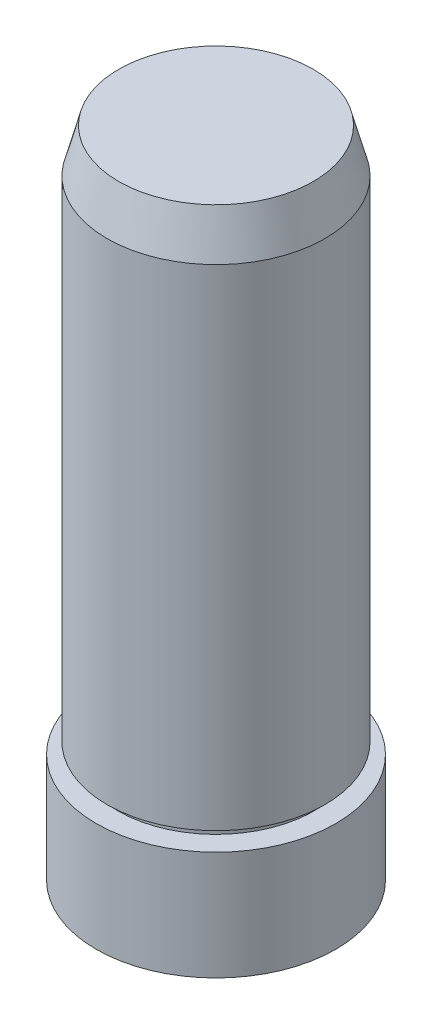
from build123d import *

# Parameters (mm, degrees)
SKETCH_1_R          = 10
EXTRUDE_1_DEPTH     = 50
SKETCH_2_R          = 11
EXTRUDE_2_DEPTH     = 10
CHAMFER_1_SIZE      = 4
CHAMFER_1_SIZE2     = 1.07179677
SKETCH_3_R          = 10
SKETCH_3_R_2        = 9
CUT_EXTRUDE_1_DEPTH = 1


with BuildPart() as part:
    # Эскиз1 → Бобышка-Вытянуть1 (new body)
    with BuildSketch(Plane(origin=(0, 0, 0), x_dir=(1, 0, 0), z_dir=(0, 1, 0))):
        Circle(SKETCH_1_R)
    extrude(amount=EXTRUDE_1_DEPTH)

    # Эскиз2 → Бобышка-Вытянуть2 (add)
    with BuildSketch(Plane.XZ):
        Circle(SKETCH_2_R)
    extrude(amount=EXTRUDE_2_DEPTH)

    # Фаска1
    chamfer_1_edges = [part.edges().sort_by_distance(p)[0] for p in [
        (-10, 50, 0),
    ]]
    chamfer_1_side = [part.faces().sort_by_distance(p)[0] for p in [
        (-10, 25, 0),
    ]]
    chamfer(chamfer_1_edges, length=CHAMFER_1_SIZE, length2=CHAMFER_1_SIZE2, reference=chamfer_1_side[0])

    # Эскиз3 → Вырез-Вытянуть1 (cut)
    with BuildSketch(Plane(origin=(0, 0, 0), x_dir=(1, 0, 0), z_dir=(0, 1, 0))):
        Circle(SKETCH_3_R)
        Circle(SKETCH_3_R_2, mode=Mode.SUBTRACT)
    extrude(amount=CUT_EXTRUDE_1_DEPTH, mode=Mode.SUBTRACT)


solid = part.part
